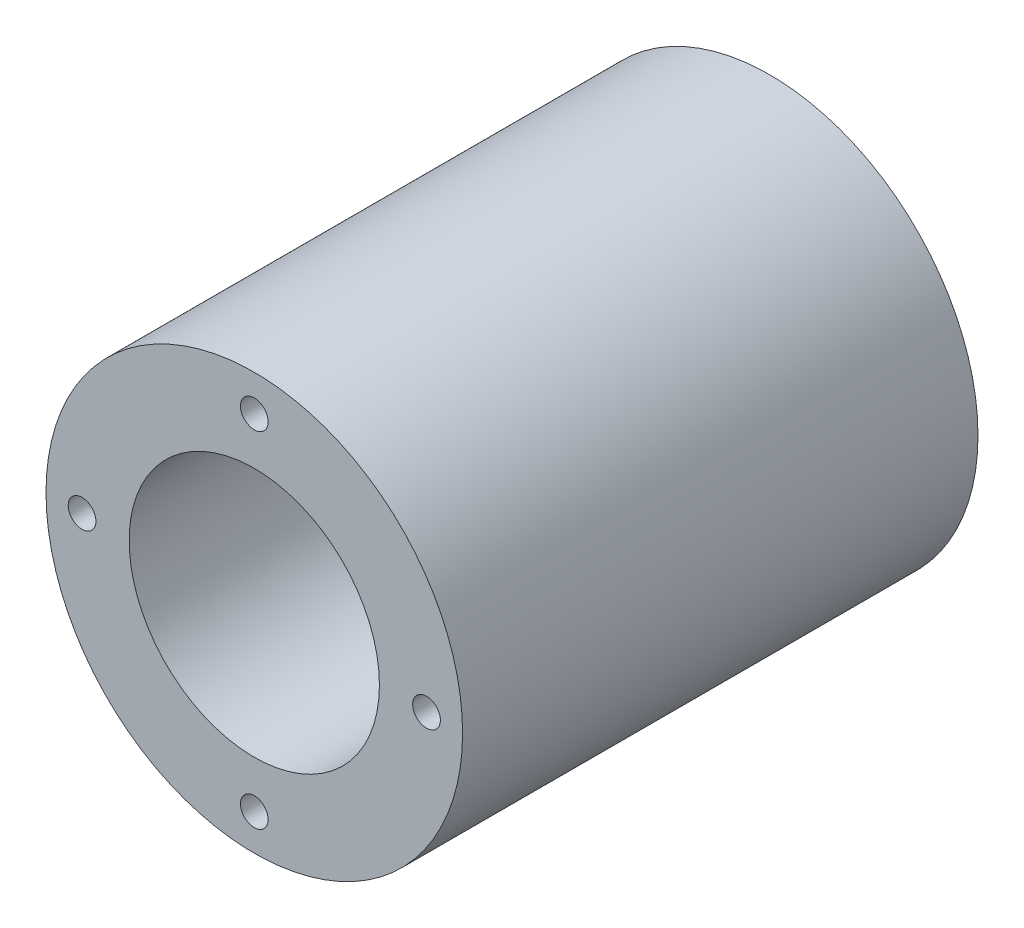
from build123d import *

# Parameters (mm, degrees)
SKETCH1_W              = 93.16400014
SKETCH1_H              = 15.03045
BACKFACEPATTERN_COUNT  = 6
FRONTFACEPATTERN_COUNT = 4
SKETCH7_R              = 26.9875
SKETCH7_R_2            = 24.60625
CUT_EXTRUDE1_DEPTH     = 0.5


with BuildPart() as part:
    # Sketch1 → Revolve1 (revolve)
    with BuildSketch(Plane(origin=(0, 0, 0), x_dir=(0, 0, -1), z_dir=(1, 0, 0))):
        with Locations((-72.887000006, 30.133925)):
            Rectangle(SKETCH1_W, SKETCH1_H)
    revolve(axis=Axis((0, 0, 119.469000076), (0, 0, -1)))

    # Sketch9 → M6x1.0 Tapped Hole3 (revolve, cut)
    with BuildSketch(Plane(origin=(0, 31.133925032, 26.304999936), x_dir=(0, 1, 0), z_dir=(1, 0, 0))):
        Polygon((0, 0), (0, 16.502151548), (2.5, 15), (2.5, 0), align=None)
    m6x1_0_tapped_hole3 = revolve(axis=Axis((0, 31.133925032, 19.954999936), (0, 0, 1)), mode=Mode.SUBTRACT)

    # BackFacePattern: M6x1.0 Tapped Hole3 ×6 about axis
    backfacepattern_axis = Axis((0, 0, 1000), (0, 0, -1))
    for i in range(1, BACKFACEPATTERN_COUNT):
        add(m6x1_0_tapped_hole3.rotate(backfacepattern_axis, i * 360 / BACKFACEPATTERN_COUNT), mode=Mode.SUBTRACT)

    # Sketch6 → M6x1.0 Tapped Hole2 (revolve, cut)
    with BuildSketch(Plane(origin=(0, 31.133925032, 119.469000076), x_dir=(0, -1, 0), z_dir=(1, 0, 0))):
        Polygon((0, 0), (0, 16.502151548), (2.5, 15), (2.5, 0), align=None)
    m6x1_0_tapped_hole2 = revolve(axis=Axis((0, 31.133925032, 125.819000076), (0, 0, -1)), mode=Mode.SUBTRACT)

    # FrontFacePattern: M6x1.0 Tapped Hole2 ×4 about axis
    frontfacepattern_axis = Axis((0, 0, 1000), (0, 0, -1))
    for i in range(1, FRONTFACEPATTERN_COUNT):
        add(m6x1_0_tapped_hole2.rotate(frontfacepattern_axis, i * 360 / FRONTFACEPATTERN_COUNT), mode=Mode.SUBTRACT)

    # Sketch7 → Cut-Extrude1 (cut)
    with BuildSketch(Plane(origin=(0, 0, 26.304999936), x_dir=(-1, 0, 0), z_dir=(0, 0, -1))):
        Circle(SKETCH7_R)
        Circle(SKETCH7_R_2, mode=Mode.SUBTRACT)
    extrude(amount=-CUT_EXTRUDE1_DEPTH, mode=Mode.SUBTRACT)


solid = part.part
